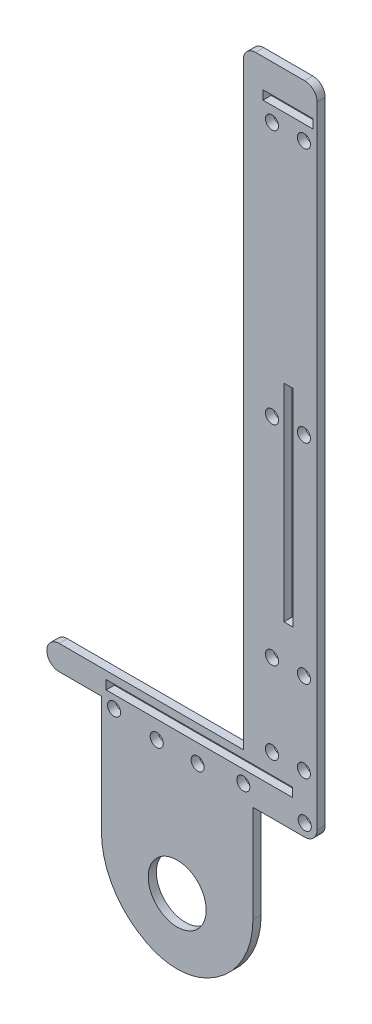
from build123d import *

# Parameters (mm, degrees)
SKETCH_1_R          = 1.6
SKETCH_1_R_2        = 7.08
SKETCH_1_W          = 45.5
SKETCH_1_H          = 2.2
SKETCH_1_W_2        = 2.2
SKETCH_1_H_2        = 50.5
SKETCH_1_W_3        = 12.2
EXTRUDE_1_DEPTH     = 2
SKETCH_2_W          = 4
SKETCH_2_H          = 160
CUT_EXTRUDE_1_DEPTH = 10
SKETCH_3_R          = 1.6
CUT_EXTRUDE_2_DEPTH = 10
FILLET_1_R          = 3


with BuildPart() as part:
    # 草图1 → 凸台-拉伸1 (new body)
    with BuildSketch(Plane.XY):
        with BuildLine():
            Line((-8.65326359, -109.246690295), (-8.65326359, -85.5))
            Line((-8.65326359, -85.5), (11, -85.5))
            Line((11, -85.5), (11, 74.5))
            Line((11, 74.5), (-11, 74.5))
            Line((-11, 74.5), (-11, -74.5))
            Line((-11, -74.5), (-59, -74.5))
            Line((-59, -74.5), (-59, -80.5))
            Line((-59, -80.5), (-45.65326359, -80.5))
            Line((-45.65326359, -80.5), (-45.65326359, -109.246690295))
            ThreePointArc((-45.65326359, -109.246690295), (-42.686252119, -119.728927736), (-34.665533413, -127.101073304))
            Line((-34.665533413, -127.101073304), (-34.351105887, -127.259785353))
            ThreePointArc((-34.351105887, -127.259785353), (-27.15326359, -128.973428312), (-19.955421292, -127.259785353))
            Line((-19.955421292, -127.259785353), (-19.640993767, -127.101073304))
            ThreePointArc((-19.640993767, -127.101073304), (-11.620275061, -119.728927736), (-8.65326359, -109.246690295))
        make_face()
        with Locations((-11, -81.629391896)):
            Circle(SKETCH_1_R, mode=Mode.SUBTRACT)
        with Locations((-42.570682945, -81.629391896)):
            Circle(SKETCH_1_R, mode=Mode.SUBTRACT)
        with Locations((-22.15326359, -83)):
            Circle(SKETCH_1_R, mode=Mode.SUBTRACT)
        with Locations((-27.15326359, -113)):
            Circle(SKETCH_1_R_2, mode=Mode.SUBTRACT)
        with Locations((-32.15326359, -83)):
            Circle(SKETCH_1_R, mode=Mode.SUBTRACT)
        with Locations((-21.75, -77.5)):
            Rectangle(SKETCH_1_W, SKETCH_1_H, mode=Mode.SUBTRACT)
        with Locations((3.8, 61.7)):
            Circle(SKETCH_1_R, mode=Mode.SUBTRACT)
        with Locations((-4, -71.5)):
            Circle(SKETCH_1_R, mode=Mode.SUBTRACT)
        with Locations((3.8, -71.5)):
            Circle(SKETCH_1_R, mode=Mode.SUBTRACT)
        with Locations((-4, -51.5)):
            Circle(SKETCH_1_R, mode=Mode.SUBTRACT)
        with Locations((3.8, -51.5)):
            Circle(SKETCH_1_R, mode=Mode.SUBTRACT)
        with Locations((0, -17.25)):
            Rectangle(SKETCH_1_W_2, SKETCH_1_H_2, mode=Mode.SUBTRACT)
        with Locations((-4, -0.5)):
            Circle(SKETCH_1_R, mode=Mode.SUBTRACT)
        with Locations((3.8, -0.5)):
            Circle(SKETCH_1_R, mode=Mode.SUBTRACT)
        with Locations((-4, 61.7)):
            Circle(SKETCH_1_R, mode=Mode.SUBTRACT)
        with Locations((-0.1, 66.4)):
            Rectangle(SKETCH_1_W_3, SKETCH_1_H, mode=Mode.SUBTRACT)
    extrude(amount=EXTRUDE_1_DEPTH)

    # 草图2 → 切除-拉伸1 (cut)
    with BuildSketch(Plane(origin=(0, 0, 0), x_dir=(-1, 0, 0), z_dir=(0, 0, -1))):
        with Locations((-9, -5.5)):
            Rectangle(SKETCH_2_W, SKETCH_2_H)
    extrude(amount=-CUT_EXTRUDE_1_DEPTH, mode=Mode.SUBTRACT)

    # 草图3 → 切除-拉伸2 (cut)
    with BuildSketch(Plane(origin=(0, 0, 0), x_dir=(-1, 0, 0), z_dir=(0, 0, -1))):
        with Locations((-4, -82.5)):
            Circle(SKETCH_3_R)
    extrude(amount=-CUT_EXTRUDE_2_DEPTH, mode=Mode.SUBTRACT)

    # 圆角1
    fillet_1_edges = [part.edges().sort_by_distance(p)[0] for p in [
        (-59, -74.5, 1),
        (-59, -80.5, 1),
        (7, -85.5, 1),
        (-11, 74.5, 1),
        (7, 74.5, 1),
    ]]
    fillet(fillet_1_edges, radius=FILLET_1_R - 0.0001)  # a hair under: the kernel refuses the full size


solid = part.part
